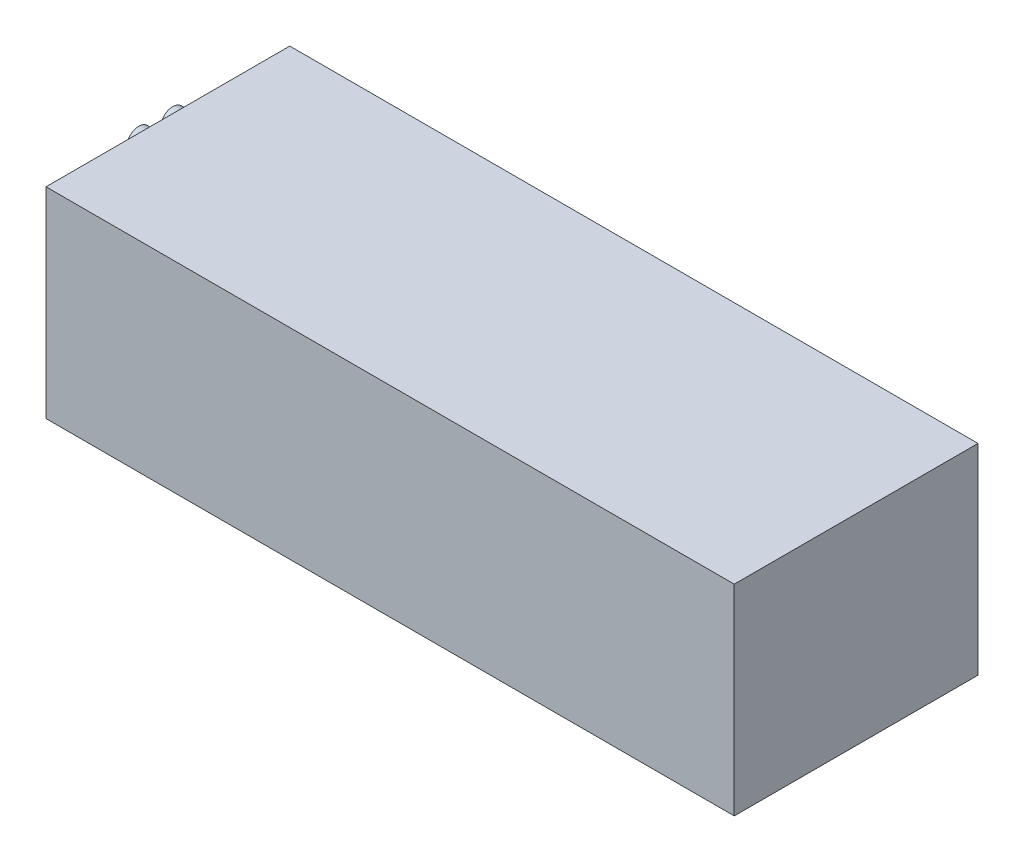
from build123d import *

# Parameters (mm, degrees)
SKETCH1_W           = 144
SKETCH1_H           = 51
BOSS_EXTRUDE1_DEPTH = 41.999916
SKETCH2_R           = 2.54
BOSS_EXTRUDE2_DEPTH = 2.54


with BuildPart() as part:
    # Sketch1 → Boss-Extrude1 (new body)
    with BuildSketch(Plane(origin=(0, 0, 0), x_dir=(1, 0, 0), z_dir=(0, 1, 0))):
        Rectangle(SKETCH1_W, SKETCH1_H)
    extrude(amount=BOSS_EXTRUDE1_DEPTH)

    # Sketch2 → Boss-Extrude2 (add)
    with BuildSketch(Plane.ZY.offset(72)):
        with Locations((-3.556, 38.189916)):
            Circle(SKETCH2_R)
        with Locations((3.556, 38.189916)):
            Circle(SKETCH2_R)
    extrude(amount=BOSS_EXTRUDE2_DEPTH)


solid = part.part
